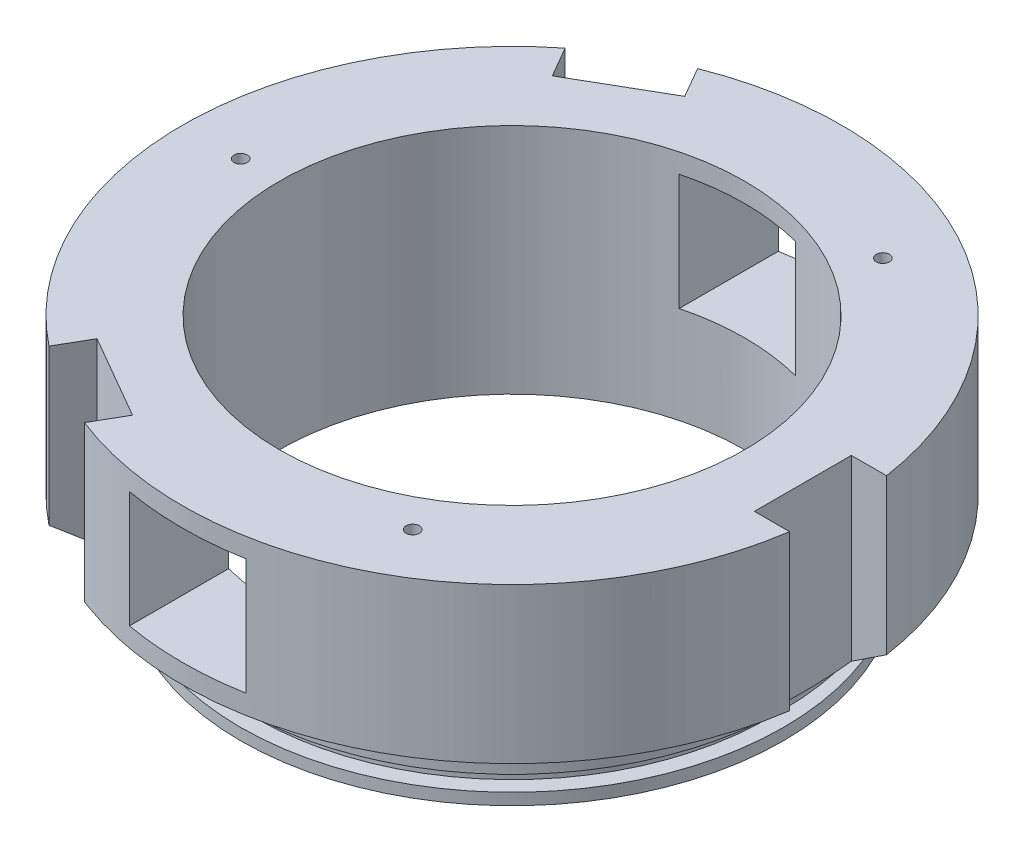
from build123d import *
from build123d.topology import SkipClean

# Parameters (mm, degrees)
SKETCH1_R           = 85
SKETCH1_R_2         = 60
BOSS_EXTRUDE1_DEPTH = 40
SKETCH4_R           = 1.7
CUT_EXTRUDE2_DEPTH  = 127.688594593
CIRPATTERN2_COUNT   = 3
SKETCH6_W           = 30
SKETCH6_H           = 30
CUT_EXTRUDE3_DEPTH  = 195.229245996
CUT_EXTRUDE1_REACH  = 136.35
SKETCH2_W           = 10
SKETCH2_H           = 25
CIRPATTERN1_COUNT   = 3


with BuildPart() as part:
    # Sketch1 → Boss-Extrude1 (new body)
    with BuildSketch(Plane(origin=(0, 0, 0), x_dir=(1, 0, 0), z_dir=(0, 1, 0))):
        Circle(SKETCH1_R)
        Circle(SKETCH1_R_2, mode=Mode.SUBTRACT)
    extrude(amount=BOSS_EXTRUDE1_DEPTH)

    # Sketch4 → Cut-Extrude2 (cut, symmetric)
    with BuildSketch(Plane(origin=(0, 40, 0), x_dir=(1, 0, 0), z_dir=(0, 1, 0))):
        with Locations((35, -60.621778265)):
            Circle(SKETCH4_R)
    cut_extrude2 = extrude(amount=CUT_EXTRUDE2_DEPTH, both=True, mode=Mode.SUBTRACT)

    # CirPattern2: Cut-Extrude2 ×3 about axis
    cirpattern2_axis = Axis((0, 0, 0), (0, 1, 0))
    for i in range(1, CIRPATTERN2_COUNT):
        add(cut_extrude2.rotate(cirpattern2_axis, i * 360 / CIRPATTERN2_COUNT), mode=Mode.SUBTRACT)

    # Sketch6 → Cut-Extrude3 (cut, through all)
    with BuildSketch(Plane.XY.offset(85)):
        with Locations((0, 20)):
            Rectangle(SKETCH6_W, SKETCH6_H)
    extrude(amount=-CUT_EXTRUDE3_DEPTH, mode=Mode.SUBTRACT)

    # Sketch8 → Revolve3 (revolve)
    with SkipClean():  # the faces are left unmerged after this step: merging them gives an invalid solid
        with BuildSketch(Plane(origin=(0, 0, 0), x_dir=(0, 0, -1), z_dir=(1, 0, 0))):
            Polygon((85, 0), (70, -10), (70, -13), (66, -13), (66, -17), (70, -17), (70, -20), (60, -20), (60, 0), align=None)
        revolve(axis=Axis((0, 0, 0), (0, 1, 0)))

    # Cut-Extrude1: up to this cone (the profile starts inside it)
    with SkipClean():  # the faces are left unmerged after this step: merging them gives an invalid solid
        cut_extrude1_end = Plane(origin=(0, 40, 0), z_dir=(0, 1, 0)).offset(-96.666665667) * Cone(1.5e-06, 567.775, 378.516665667, align=(Align.CENTER, Align.CENTER, Align.MIN), mode=Mode.PRIVATE)
        # Sketch2 → Cut-Extrude1 (cut, up to the surface)
        with BuildSketch(Plane(origin=(0, 40, 0), x_dir=(1, 0, 0), z_dir=(0, 1, 0)), mode=Mode.PRIVATE) as cut_extrude1_sk1:
            with Locations((80, 0)):
                Rectangle(SKETCH2_W, SKETCH2_H)
        cut_extrude1_tool1 = extrude(cut_extrude1_sk1.sketch, amount=-CUT_EXTRUDE1_REACH, mode=Mode.PRIVATE) & cut_extrude1_end
        cut_extrude1 = cut_extrude1_tool1.solids().sort_by_distance((80, 40, 0))[0]
        add(cut_extrude1, mode=Mode.SUBTRACT)

    # CirPattern1: Cut-Extrude1 ×3 about axis
    with SkipClean():  # the faces are left unmerged after this step: merging them gives an invalid solid
        cirpattern1_axis = Axis((0, 0, 0), (0, 1, 0))
        for i in range(1, CIRPATTERN1_COUNT):
            add(cut_extrude1.rotate(cirpattern1_axis, i * 360 / CIRPATTERN1_COUNT), mode=Mode.SUBTRACT)


solid = part.part
